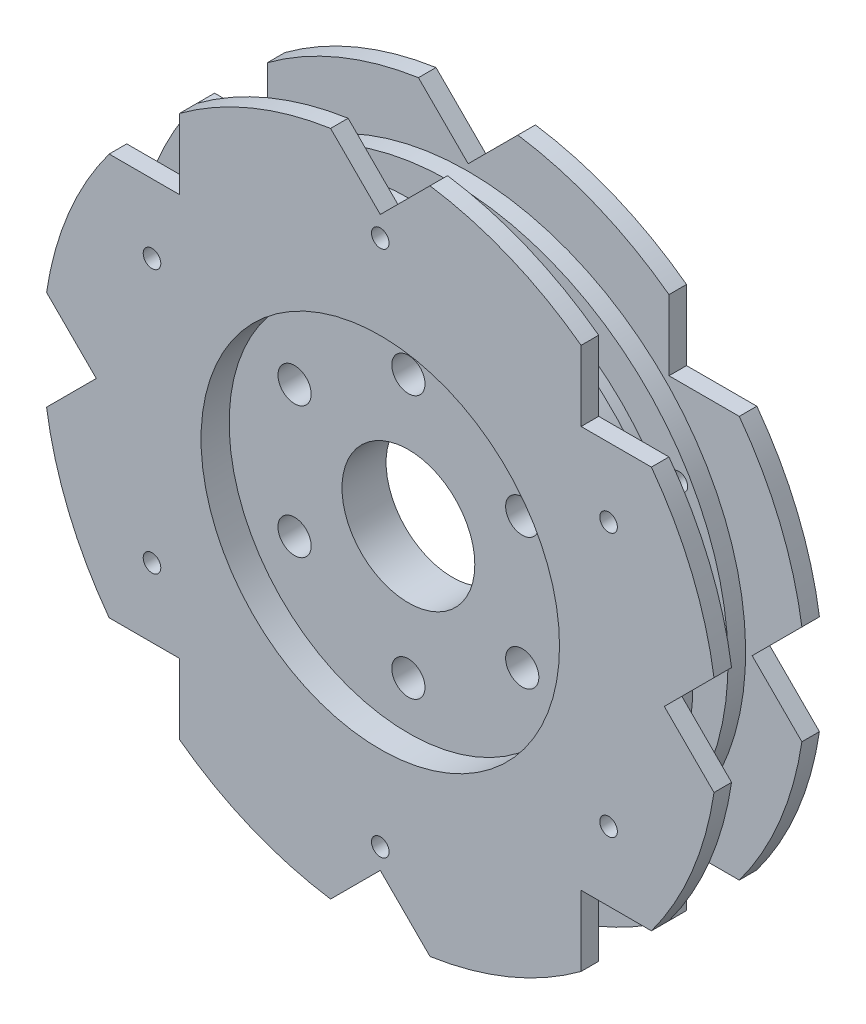
from build123d import *

# Parameters (mm, degrees)
BOSS_EXTRUDE1_DEPTH        = 19.05
SKETCH2_R                  = 12
CUT_EXTRUDE1_DEPTH         = 88.371938859
SKETCH3_R                  = 32.385
CUT_EXTRUDE2_DEPTH         = 5.08
SKETCH4_R                  = 28.4
CUT_EXTRUDE3_DEPTH         = 6
F_6_0MM_DOWEL_HOLE1_D      = 6
F_1_8_0_1250_DOWEL_HOLE1_D = 3.175


with BuildPart() as part:
    # Sketch1 → Boss-Extrude1 (new body)
    with BuildSketch(Plane.XY):
        with BuildLine():
            Line((-8.980256121, 60.29491355), (0, 51.314657429))
            Line((0, 51.314657429), (8.980256121, 60.29491355))
            ThreePointArc((8.980256121, 60.29491355), (23.328382037, 56.319696302), (36.284942242, 48.984942242))
            Line((36.284942242, 48.984942242), (36.284942242, 36.284942242))
            Line((36.284942242, 36.284942242), (48.984942242, 36.284942242))
            ThreePointArc((48.984942242, 36.284942242), (56.319696302, 23.328382037), (60.29491355, 8.980256121))
            Line((60.29491355, 8.980256121), (51.314657429, 0))
            Line((51.314657429, 0), (60.29491355, -8.980256121))
            ThreePointArc((60.29491355, -8.980256121), (56.319696302, -23.328382037), (48.984942242, -36.284942242))
            Line((48.984942242, -36.284942242), (36.284942242, -36.284942242))
            Line((36.284942242, -36.284942242), (36.284942242, -48.984942242))
            ThreePointArc((36.284942242, -48.984942242), (23.328382037, -56.319696302), (8.980256121, -60.29491355))
            Line((8.980256121, -60.29491355), (0, -51.314657429))
            Line((0, -51.314657429), (-8.980256121, -60.29491355))
            ThreePointArc((-8.980256121, -60.29491355), (-23.328382037, -56.319696302), (-36.284942242, -48.984942242))
            Line((-36.284942242, -48.984942242), (-36.284942242, -36.284942242))
            Line((-36.284942242, -36.284942242), (-48.984942242, -36.284942242))
            ThreePointArc((-48.984942242, -36.284942242), (-56.319696302, -23.328382037), (-60.29491355, -8.980256121))
            Line((-60.29491355, -8.980256121), (-51.314657429, 0))
            Line((-51.314657429, 0), (-60.29491355, 8.980256121))
            ThreePointArc((-60.29491355, 8.980256121), (-56.319696302, 23.328382037), (-48.984942242, 36.284942242))
            Line((-48.984942242, 36.284942242), (-36.284942242, 36.284942242))
            Line((-36.284942242, 36.284942242), (-36.284942242, 48.984942242))
            ThreePointArc((-36.284942242, 48.984942242), (-23.328382037, 56.319696302), (-8.980256121, 60.29491355))
        make_face()
    extrude(amount=BOSS_EXTRUDE1_DEPTH)

    # Sketch2 → Cut-Extrude1 (cut, through all)
    with BuildSketch(Plane.XY.offset(19.05)):
        Circle(SKETCH2_R)
    extrude(amount=-CUT_EXTRUDE1_DEPTH, mode=Mode.SUBTRACT)

    # Sketch3 → Cut-Extrude2 (cut)
    with BuildSketch(Plane.XY.offset(19.05)):
        Circle(SKETCH3_R)
    extrude(amount=-CUT_EXTRUDE2_DEPTH, mode=Mode.SUBTRACT)

    # Sketch4 → Cut-Extrude3 (cut)
    with BuildSketch(Plane(origin=(0, 0, 0), x_dir=(-1, 0, 0), z_dir=(0, 0, -1))):
        Circle(SKETCH4_R)
    extrude(amount=-CUT_EXTRUDE3_DEPTH, mode=Mode.SUBTRACT)

    # Ø6.0mm Dowel Hole1 (through all)
    with Locations(Plane(origin=(0, 0, 6), x_dir=(-1, 0, 0), z_dir=(0, 0, -1))):
        with Locations((0, 23.75), (20.56810334, 11.875), (20.56810334, -11.875), (0, -23.75), (-20.56810334, 11.875), (-20.56810334, -11.875)):
            Hole(F_6_0MM_DOWEL_HOLE1_D / 2)

    # Sketch12 → Cut-Revolve1 (revolve, cut)
    with BuildSketch(Plane(origin=(0, 0, 0), x_dir=(0, 0, -1), z_dir=(1, 0, 0))):
        Polygon((-3.175, 62.83491355), (-15.875, 62.83491355), (-15.875, 50.13491355), (-12.7, 50.13491355), (-12.7, 43.78491355), (-6.35, 43.78491355), (-6.35, 50.13491355), (-3.175, 50.13491355), align=None)
    revolve(axis=Axis((0, 0, 0), (0, 0, 1)), mode=Mode.SUBTRACT)

    # 1/8 (0.1250) Dowel Hole1 (through all)
    with Locations(Plane(origin=(0, 0, 0), x_dir=(-1, 0, 0), z_dir=(0, 0, -1))):
        with Locations((-41.244459855, 23.8125), (0, 47.625), (41.244459855, 23.8125), (41.244459855, -23.8125), (0, -47.625), (-41.244459855, -23.8125)):
            Hole(F_1_8_0_1250_DOWEL_HOLE1_D / 2)


solid = part.part
